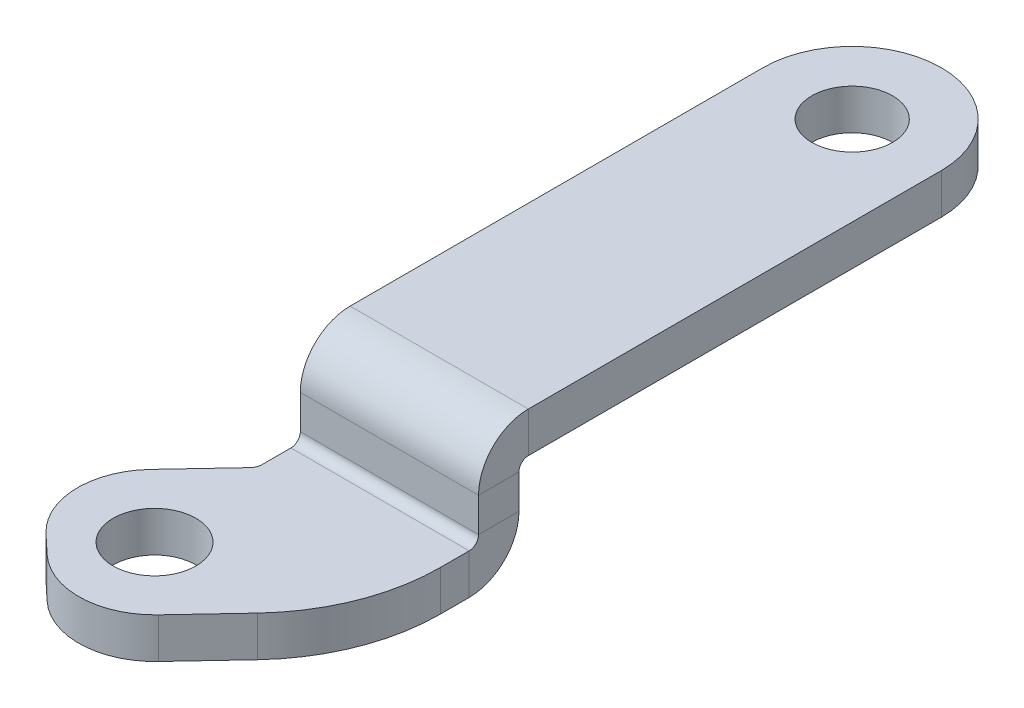
from build123d import *

# Parameters (mm, degrees)
SKETCH1_R                    = 3.25
BASE_FLANGE1_DEPTH           = 3.175
EDGE_FLANGE1_STRIP_W         = 14.1732
EDGE_FLANGE1_STRIP_H         = 3.175
EDGE_FLANGE1_STRIP_CUT_DEPTH = 14
EDGE_FLANGE1_DEPTH           = 14
EDGE_FLANGE2_STRIP_W         = 14.1732
EDGE_FLANGE2_STRIP_H         = 3.175
EDGE_FLANGE2_STRIP_CUT_DEPTH = 14
EDGE_FLANGE2_DEPTH           = 14
SKETCH17_R                   = 3.175
CUT_EXTRUDE1_DEPTH           = 3.175


# Sheet-metal steps are written as plain solids
with BuildPart() as part:
    # Sketch1 → Base-Flange1 (new body)
    with BuildSketch(Plane(origin=(0, 0, 0), x_dir=(1, 0, 0), z_dir=(0, 1, 0))):
        with BuildLine():
            Line((12.950003607, 12.5), (-1.049996393, 12.5))
            Line((-1.049996393, 12.5), (-1.049996393, 9.5))
            ThreePointArc((-1.049996393, 9.5), (-1.120300603, 9.131671699), (-1.321327868, 8.815133458))
            Line((-1.321327868, 8.815133458), (-5.100679674, 4.794065797))
            ThreePointArc((-5.100679674, 4.794065797), (-6.725789914, 0.499030469), (-4.837867779, -3.687144607))
            Line((-4.837867779, -3.687144607), (-3.380530729, -5.056877692))
            ThreePointArc((-3.380530729, -5.056877692), (0.914504598, -6.681987931), (5.100679674, -4.794065797))
            Line((5.100679674, -4.794065797), (8.88003148, -0.772998135))
            ThreePointArc((8.88003148, -0.772998135), (11.895440461, 3.97507548), (12.950003607, 9.5))
            Line((12.950003607, 9.5), (12.950003607, 12.5))
        make_face()
        with Locations(Location((0, 0, 0), (0, 0, 270))):
            Circle(SKETCH1_R, mode=Mode.SUBTRACT)
    extrude(amount=-BASE_FLANGE1_DEPTH)

    # Edge-Flange1 strip (across the edge) → Edge-Flange1 strip cut (cut)
    with BuildSketch(Plane(origin=(12.950003607, 0, -12.5), x_dir=(0, 0, 1), z_dir=(-1, 0, 0))):
        with Locations((-6.35, -1.5875)):
            Rectangle(EDGE_FLANGE1_STRIP_W, EDGE_FLANGE1_STRIP_H)
    extrude(amount=EDGE_FLANGE1_STRIP_CUT_DEPTH, mode=Mode.SUBTRACT)

    # Edge-Flange1 section (across the edge) → Edge-Flange1 (add)
    with BuildSketch(Plane(origin=(12.950003607, 0, -12.5), x_dir=(0, 0, 1), z_dir=(-1, 0, 0))):
        with BuildLine():
            Line((-3.175, 0.7366), (-3.175, 7.324994814))
            Line((-3.175, 7.324994814), (0, 7.324994814))
            Line((0, 7.324994814), (0, 0.7366))
            ThreePointArc((0, 0.7366), (0.215745145, 0.215745145), (0.7366, 0))
            Line((0.7366, 0), (0.7366, -3.175))
            ThreePointArc((0.7366, -3.175), (-2.029318885, -2.029318885), (-3.175, 0.7366))
        make_face()
    extrude(amount=EDGE_FLANGE1_DEPTH)

    # Edge-Flange2 strip (across the edge) → Edge-Flange2 strip cut (cut)
    with BuildSketch(Plane(origin=(-1.049996393, 7.324994814, -15.675), x_dir=(0, -1, 0), z_dir=(1, 0, 0))):
        with Locations((-3.175, -1.5875)):
            Rectangle(EDGE_FLANGE2_STRIP_W, EDGE_FLANGE2_STRIP_H)
    extrude(amount=EDGE_FLANGE2_STRIP_CUT_DEPTH, mode=Mode.SUBTRACT)

    # Edge-Flange2 section (across the edge) → Edge-Flange2 (add)
    with BuildSketch(Plane(origin=(-1.049996393, 7.324994814, -15.675), x_dir=(0, -1, 0), z_dir=(1, 0, 0))):
        with BuildLine():
            Line((0, 0.7366), (0, 40.174998631))
            Line((0, 40.174998631), (3.175, 40.174998631))
            Line((3.175, 40.174998631), (3.175, 0.7366))
            ThreePointArc((3.175, 0.7366), (3.390745145, 0.215745145), (3.9116, 0))
            Line((3.9116, 0), (3.9116, -3.175))
            ThreePointArc((3.9116, -3.175), (1.145681115, -2.029318885), (0, 0.7366))
        make_face()
    extrude(amount=EDGE_FLANGE2_DEPTH)

    # Sketch17 → Cut-Extrude1 (cut)
    with BuildSketch(Plane(origin=(0, 7.324994814, 0), x_dir=(1, 0, 0), z_dir=(0, 1, 0))):
        with BuildLine():
            ThreePointArc((-1.049996393, 48.849998631), (1.000256139, 53.7997461), (5.950003607, 55.849998631))
            Line((5.950003607, 55.849998631), (-1.049996393, 55.849998631))
            Line((-1.049996393, 55.849998631), (-1.049996393, 48.849998631))
        make_face()
        with BuildLine():
            ThreePointArc((5.950003607, 55.849998631), (10.899751075, 53.7997461), (12.950003607, 48.849998631))
            Line((12.950003607, 48.849998631), (12.950003607, 55.849998631))
            Line((12.950003607, 55.849998631), (5.950003607, 55.849998631))
        make_face()
        with Locations(Location((5.950003607, 48.849998631, 0), (0, 0, 270))):
            Circle(SKETCH17_R)
    extrude(amount=-CUT_EXTRUDE1_DEPTH, mode=Mode.SUBTRACT)


solid = part.part
